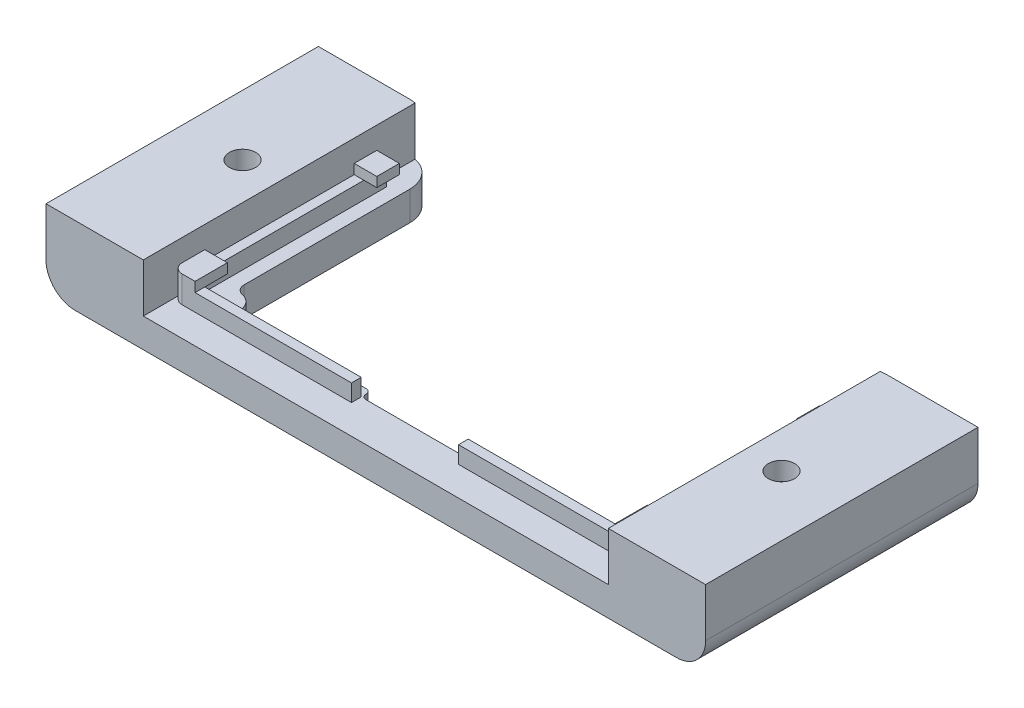
from build123d import *

# Parameters (mm, degrees)
SKETCH1_R                = 8.05
SKETCH1_R_2              = 0.8
BOSS_EXTRUDE1_DEPTH      = 3
SKETCH1_5_R              = 0.8
BOSS_EXTRUDE3_DEPTH      = 3
CUT_EXTRUDE2_REACH       = 32.121
SKETCH5_R                = 8.05
FILLET2_R                = 1
BOSS_EXTRUDE4_DEPTH      = 1.75
BOSS_EXTRUDE7_START      = 1.75
SKETCH6_5_W              = 2.32
SKETCH6_5_H              = 2.32
BOSS_EXTRUDE7_DEPTH      = 1
SKETCH7_W                = 10
SKETCH7_H                = 28
BOSS_EXTRUDE8_DEPTH      = 8
SKETCH8_R                = 1.35
CUT_EXTRUDE3_DEPTH       = 1.1
CUT_EXTRUDE4_DEPTH       = 38.01634774
CUT_EXTRUDE4_DEPTH_BACK  = 38.01634774
SKETCH8_3_R              = 1.35
BOSS_EXTRUDE9_DEPTH      = 20
BOSS_EXTRUDE9_DEPTH_BACK = 20
SKETCH10_W               = 5
SKETCH10_H               = 3
CUT_EXTRUDE5_REACH       = 39.539
SKETCH9_W                = 43
SKETCH9_H                = 7.971706725
CUT_EXTRUDE6_REACH       = 39.016
SKETCH12_W               = 11
SKETCH12_H               = 1
FILLET3_R                = 3
FILLET4_START            = -1
FILLET4_DEPTH            = 5
FILLET4_2_DEPTH          = 3


with BuildPart() as part:
    # Sketch1 → Boss-Extrude1 (new body)
    with BuildSketch(Plane(origin=(0, 0, 0), x_dir=(1, 0, 0), z_dir=(0, 1, 0))):
        with BuildLine():
            Line((5.5, -7), (5.5, -14))
            Line((5.5, -14), (25.5, -14))
            ThreePointArc((25.5, -14), (26.207106781, -13.707106781), (26.5, -13))
            Line((26.5, -13), (26.5, 13))
            ThreePointArc((26.5, 13), (26.207106781, 13.707106781), (25.5, 14))
            Line((25.5, 14), (-25.5, 14))
            ThreePointArc((-25.5, 14), (-26.207106781, 13.707106781), (-26.5, 13))
            Line((-26.5, 13), (-26.5, -13))
            ThreePointArc((-26.5, -13), (-26.207106781, -13.707106781), (-25.5, -14))
            Line((-25.5, -14), (-5.5, -14))
            Line((-5.5, -14), (-5.5, -7))
            Line((-5.5, -7), (5.5, -7))
        make_face()
        with Locations(Location((-12.95, 0, 0), (0, 0, 270))):
            Circle(SKETCH1_R, mode=Mode.SUBTRACT)
        with Locations(Location((12.95, 0, 0), (0, 0, 270))):
            Circle(SKETCH1_R, mode=Mode.SUBTRACT)
        with BuildLine():
            ThreePointArc((-3.25, 5.75), (-5.25, 7.75), (-3.25, 9.75))
            Line((-3.25, 9.75), (3.25, 9.75))
            ThreePointArc((3.25, 9.75), (5.25, 7.75), (3.25, 5.75))
            Line((3.25, 5.75), (-3.25, 5.75))
        make_face(mode=Mode.SUBTRACT)
        with Locations(Location((-20.99, 8.49, 0), (0, 0, 270))):
            Circle(SKETCH1_R_2, mode=Mode.SUBTRACT)
        with Locations(Location((20.99, 8.49, 0), (0, 0, 270))):
            Circle(SKETCH1_R_2, mode=Mode.SUBTRACT)
        with Locations(Location((20.99, -8.49, 0), (0, 0, 270))):
            Circle(SKETCH1_R_2, mode=Mode.SUBTRACT)
        with Locations(Location((-20.99, -8.49, 0), (0, 0, 270))):
            Circle(SKETCH1_R_2, mode=Mode.SUBTRACT)
    extrude(amount=BOSS_EXTRUDE1_DEPTH)

    # Sketch1<5> → Boss-Extrude3 (add)
    with BuildSketch(Plane(origin=(0, 0, 0), x_dir=(1, 0, 0), z_dir=(0, 1, 0))):
        with Locations((20.99, 8.49)):
            Circle(SKETCH1_5_R)
        with Locations((-20.99, 8.49)):
            Circle(SKETCH1_5_R)
        with Locations((-20.99, -8.49)):
            Circle(SKETCH1_5_R)
        with Locations((20.99, -8.49)):
            Circle(SKETCH1_5_R)
    extrude(amount=BOSS_EXTRUDE3_DEPTH)

    # Sketch5 → Cut-Extrude2 (cut, up to next)
    with BuildSketch(Plane(origin=(0, 3, 0), x_dir=(1, 0, 0), z_dir=(0, 1, 0)), mode=Mode.PRIVATE) as cut_extrude2_sk1:
        with BuildLine():
            Line((3.25, 5.75), (-3.25, 5.75))
            ThreePointArc((-3.25, 5.75), (-5.052775638, 6.883974596), (-4.8112495, 9))
            Line((-4.8112495, 9), (-19.56873296, 9))
            ThreePointArc((-19.56873296, 9), (-19.502348624, 8.748830803), (-19.48, 8.49))
            ThreePointArc((-19.48, 8.49), (-20.12109264, 7.255050608), (-21.5, 7.06873296))
            Line((-21.5, 7.06873296), (-21.5, -7.06873296))
            ThreePointArc((-21.5, -7.06873296), (-20.12109264, -7.255050608), (-19.48, -8.49))
            ThreePointArc((-19.48, -8.49), (-19.502348624, -8.748830803), (-19.56873296, -9))
            Line((-19.56873296, -9), (-5.5, -9))
            Line((-5.5, -9), (-5.5, -7))
            Line((-5.5, -7), (5.5, -7))
            Line((5.5, -7), (5.5, -9))
            Line((5.5, -9), (19.56873296, -9))
            ThreePointArc((19.56873296, -9), (19.92226876, -7.42226876), (21.5, -7.06873296))
            Line((21.5, -7.06873296), (21.5, 7.06873296))
            ThreePointArc((21.5, 7.06873296), (19.92226876, 7.42226876), (19.56873296, 9))
            Line((19.56873296, 9), (4.8112495, 9))
            ThreePointArc((4.8112495, 9), (5.052775638, 6.883974596), (3.25, 5.75))
        make_face()
        with Locations((-12.95, 0)):
            Circle(SKETCH5_R, mode=Mode.SUBTRACT)
        with Locations((12.95, 0)):
            Circle(SKETCH5_R, mode=Mode.SUBTRACT)
    cut_extrude2_tool1 = extrude(cut_extrude2_sk1.sketch, amount=-CUT_EXTRUDE2_REACH, mode=Mode.PRIVATE) & part.part
    add(cut_extrude2_tool1.solids().sort_by_distance((0, 3, 0.207713))[0], mode=Mode.SUBTRACT)

    # Fillet2
    fillet2_edges = [part.edges().sort_by_distance(p)[0] for p in [
        (21.5, 1.5, 7.06873296),
        (19.56873296, 1.5, 9),
        (5.5, 1.5, 9),
        (-5.5, 1.5, 9),
        (-19.56873296, 1.5, 9),
        (-21.5, 1.5, 7.06873296),
        (-21.5, 1.5, -7.06873296),
        (-19.56873296, 1.5, -9),
        (-4.8112495, 1.5, -9),
        (4.8112495, 1.5, -9),
        (19.56873296, 1.5, -9),
        (21.5, 1.5, -7.06873296),
    ]]
    fillet(fillet2_edges, radius=FILLET2_R)

    # Sketch6 → Boss-Extrude4 (add)
    with BuildSketch(Plane(origin=(0, 3, 0), x_dir=(1, 0, 0), z_dir=(0, 1, 0))):
        with BuildLine():
            ThreePointArc((-23.9, -10), (-23.607106781, -10.707106781), (-22.9, -11))
            Line((-22.9, -11), (-5.5, -11))
            Line((-5.5, -11), (-5.5, -10))
            Line((-5.5, -10), (-22.9, -10))
            Line((-22.9, -10), (-22.9, 10))
            Line((-22.9, 10), (-23.9, 10))
            Line((-23.9, 10), (-23.9, -10))
        make_face()
    boss_extrude4 = extrude(amount=BOSS_EXTRUDE4_DEPTH)

    # Sketch6<5> → Boss-Extrude7 (add)
    with BuildSketch(Plane(origin=(0, 3, 0), x_dir=(1, 0, 0), z_dir=(0, 1, 0)).offset(BOSS_EXTRUDE7_START)):
        with BuildLine():
            Line((-23.9, -7.68), (-23.9, -10))
            ThreePointArc((-23.9, -10), (-23.607106781, -10.707106781), (-22.9, -11))
            Line((-22.9, -11), (-21.58, -11))
            Line((-21.58, -11), (-21.58, -7.68))
            Line((-21.58, -7.68), (-23.9, -7.68))
        make_face()
        with Locations((-22.74, 8.84)):
            Rectangle(SKETCH6_5_W, SKETCH6_5_H)
    boss_extrude7 = extrude(amount=BOSS_EXTRUDE7_DEPTH)

    # Mirror1: Boss-Extrude4, Boss-Extrude7 across plane
    add(boss_extrude4.mirror(Plane(origin=(0, 0, 0), x_dir=(0, 0, 1), z_dir=(1, 0, 0))))
    add(boss_extrude7.mirror(Plane(origin=(0, 0, 0), x_dir=(0, 0, 1), z_dir=(1, 0, 0))))

    # Sketch7 → Boss-Extrude8 (add)
    with BuildSketch(Plane(origin=(0, 0, 0), x_dir=(1, 0, 0), z_dir=(0, 1, 0))):
        with Locations((-28.9, 0)):
            Rectangle(SKETCH7_W, SKETCH7_H)
        with Locations((28.9, 0)):
            Rectangle(SKETCH7_W, SKETCH7_H)
    extrude(amount=BOSS_EXTRUDE8_DEPTH)

    # Sketch8 → Cut-Extrude3 (cut, symmetric)
    with BuildSketch(Plane(origin=(0, 5, 0), x_dir=(-1, 0, 0), z_dir=(0, -1, 0))):
        Polygon((-30.3, 1.5011107), (-30.3, -1.5011107), (-27.7, -3.0022214), (-25.1, -1.5011107), (-25.1, 1.5011107), (-27.7, 3.0022214), align=None)
        Polygon((-25.1, 1.5011107), (-25.1, 14), (-30.3, 14), (-30.3, 1.5011107), (-27.7, 3.0022214), align=None)
        Polygon((25.1, 14), (30.3, 14), (30.3, 1.5011107), (27.7, 3.0022214), (25.1, 1.5011107), align=None)
        Polygon((30.3, -1.5011107), (27.7, -3.0022214), (25.1, -1.5011107), (25.1, 1.5011107), (27.7, 3.0022214), (30.3, 1.5011107), align=None)
        with Locations((27.7, 0)):
            Circle(SKETCH8_R)
        with Locations((-27.7, 0)):
            Circle(SKETCH8_R)
    extrude(amount=CUT_EXTRUDE3_DEPTH, both=True, mode=Mode.SUBTRACT)

    # Sketch8<3> → Cut-Extrude4 (cut, two sides: drawn at the far end of the back side and taken through both)
    with BuildSketch(Plane(origin=(0, 5, 0), x_dir=(-1, 0, 0), z_dir=(0, -1, 0)).offset(-CUT_EXTRUDE4_DEPTH_BACK)):
        with Locations(Location((-27.7, 0, 0), (0, 0, 90))):
            Circle(SKETCH8_3_R)
        with Locations(Location((27.7, 0, 0), (0, 0, 90))):
            Circle(SKETCH8_3_R)
    extrude(amount=CUT_EXTRUDE4_DEPTH + CUT_EXTRUDE4_DEPTH_BACK, mode=Mode.SUBTRACT)

    # Sketch10 → Boss-Extrude9 (add, two sides: drawn at the far end of the back side and taken through both)
    with BuildSketch(Plane(origin=(-5.5, 0, 0), x_dir=(0, 0, -1), z_dir=(1, 0, 0)).offset(-BOSS_EXTRUDE9_DEPTH_BACK)):
        with Locations((-11.5, 1.5)):
            Rectangle(SKETCH10_W, SKETCH10_H)
    extrude(amount=BOSS_EXTRUDE9_DEPTH + BOSS_EXTRUDE9_DEPTH_BACK)

    # Sketch9 → Cut-Extrude5 (cut, up to next)
    with BuildSketch(Plane.XZ, mode=Mode.PRIVATE) as cut_extrude5_sk1:
        with Locations((0, -10.014146637)):
            Rectangle(SKETCH9_W, SKETCH9_H)
    cut_extrude5_tool1 = extrude(cut_extrude5_sk1.sketch, amount=-CUT_EXTRUDE5_REACH, mode=Mode.PRIVATE) & part.part
    add(cut_extrude5_tool1.solids().sort_by_distance((0, 0, -10.014147))[0], mode=Mode.SUBTRACT)

    # Sketch12 → Cut-Extrude6 (cut, up to next)
    with BuildSketch(Plane(origin=(0, 3, 0), x_dir=(1, 0, 0), z_dir=(0, 1, 0)), mode=Mode.PRIVATE) as cut_extrude6_sk1:
        with Locations((0, -9.5)):
            Rectangle(SKETCH12_W, SKETCH12_H)
    cut_extrude6_tool1 = extrude(cut_extrude6_sk1.sketch, amount=-CUT_EXTRUDE6_REACH, mode=Mode.PRIVATE) & part.part
    add(cut_extrude6_tool1.solids().sort_by_distance((0, 3, 9.5))[0], mode=Mode.SUBTRACT)

    # Fillet3
    fillet3_edges = [part.edges().sort_by_distance(p)[0] for p in [
        (33.9, 0, 0),
        (-33.9, 0, 0),
        (21.5, 1.5, -14),
        (-21.5, 1.5, -14),
    ]]
    fillet(fillet3_edges, radius=FILLET3_R)

    # Fillet4: read off the stored shape, not the designer's step
    # Fillet4 outline → Fillet4 (cut)
    with BuildSketch(Plane(origin=(0, 0, 0), x_dir=(1, 0, 0), z_dir=(0, 1, 0)).offset(FILLET4_START)):
        with BuildLine():
            Line((5.5, -9), (5.5, -9.5))
            ThreePointArc((5.5, -9.5), (5.646446609, -9.146446609), (6, -9))
            Line((6, -9), (5.5, -9))
        make_face()
        with BuildLine():
            ThreePointArc((-6, -9), (-5.646446609, -9.146446609), (-5.5, -9.5))
            Line((-5.5, -9.5), (-5.5, -9))
            Line((-5.5, -9), (-6, -9))
        make_face()
    extrude(amount=FILLET4_DEPTH, mode=Mode.SUBTRACT)

    # Fillet4 2 outline → Fillet4 2 (add)
    with BuildSketch(Plane(origin=(0, 0, 0), x_dir=(1, 0, 0), z_dir=(0, 1, 0))):
        with BuildLine():
            ThreePointArc((5.5, -9.5), (5.353553391, -9.853553391), (5, -10))
            Line((5, -10), (5.5, -10))
            Line((5.5, -10), (5.5, -9.5))
        make_face()
        with BuildLine():
            ThreePointArc((-5, -10), (-5.353553391, -9.853553391), (-5.5, -9.5))
            Line((-5.5, -9.5), (-5.5, -10))
            Line((-5.5, -10), (-5, -10))
        make_face()
    extrude(amount=FILLET4_2_DEPTH)


solid = part.part
